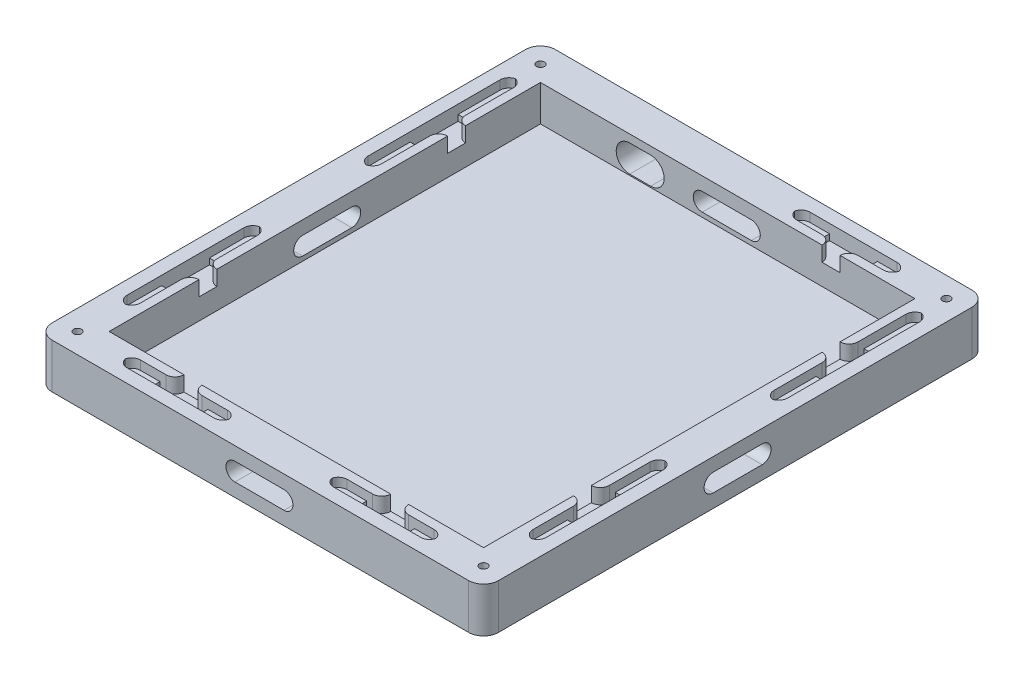
from build123d import *

# Parameters (mm, degrees)
FLOOR_2_DEPTH            = 3
BOSS_EXTRUDE1_DEPTH      = 12
BOSS_EXTRUDE1_DEPTH_BACK = 3
SKETCH4_W                = 149
SKETCH4_H                = 168
SKETCH4_W_2              = 125
SKETCH4_H_2              = 144
FILLET1_R                = 5
FILLET2_R                = 5
FILLET3_R                = 5
FILLET4_R                = 5
CUT_EXTRUDE1_DEPTH       = 3
CUT_EXTRUDE2_DEPTH       = 2
CUT_EXTRUDE3_DEPTH       = 172.703232352
CUT_EXTRUDE4_DEPTH       = 185.388855412
SKETCH9_R                = 1.325
CUT_EXTRUDE5_DEPTH       = 17
SKETCH10_R               = 3
CUT_EXTRUDE6_DEPTH       = 5
SKETCH11_R               = 6.25
CUT_EXTRUDE7_DEPTH       = 1
CUT_EXTRUDE8_DEPTH       = 20
FILLET5_R                = 3
FILLET6_R                = 3
FILLET7_R                = 3
FILLET8_R                = 3
FILLET9_R                = 3
FILLET10_R               = 3
FILLET11_R               = 3
FILLET12_R               = 3


# Some blends are built 0.0001 mm under size
with BuildPart() as part:
    # Sketch1 → Floor 2 (new body)
    with BuildSketch(Plane(origin=(0, 0, 0), x_dir=(1, 0, 0), z_dir=(0, 1, 0))):
        Polygon((-62.5, 55.915), (-62.5, 72), (-47.54, 72), (46.365, 72), (62.5, 72), (62.5, 55.915), (62.5, -57.04), (62.5, -72), (46.365, -72), (-47.54, -72), (-62.5, -72), (-62.5, -57.04), align=None)
    extrude(amount=FLOOR_2_DEPTH)

    # Sketch4 → Boss-Extrude1 (add, two sides: drawn at the far end of the back side and taken through both)
    with BuildSketch(Plane(origin=(0, 3, 0), x_dir=(1, 0, 0), z_dir=(0, 1, 0)).offset(-BOSS_EXTRUDE1_DEPTH_BACK)):
        Rectangle(SKETCH4_W, SKETCH4_H)
        Rectangle(SKETCH4_W_2, SKETCH4_H_2, mode=Mode.SUBTRACT)
    extrude(amount=BOSS_EXTRUDE1_DEPTH + BOSS_EXTRUDE1_DEPTH_BACK)

    # Fillet1
    fillet1_edges = [part.edges().sort_by_distance(p)[0] for p in [
        (-74.5, 7.5, 84),
    ]]
    fillet(fillet1_edges, radius=FILLET1_R)

    # Fillet2
    fillet2_edges = [part.edges().sort_by_distance(p)[0] for p in [
        (74.5, 7.5, 84),
    ]]
    fillet(fillet2_edges, radius=FILLET2_R)

    # Fillet3
    fillet3_edges = [part.edges().sort_by_distance(p)[0] for p in [
        (74.5, 7.5, -84),
    ]]
    fillet(fillet3_edges, radius=FILLET3_R)

    # Fillet4
    fillet4_edges = [part.edges().sort_by_distance(p)[0] for p in [
        (-74.5, 7.5, -84),
    ]]
    fillet(fillet4_edges, radius=FILLET4_R)

    # Sketch5 → Cut-Extrude1 (cut)
    with BuildSketch(Plane(origin=(0, 15, 0), x_dir=(1, 0, 0), z_dir=(0, 1, 0))):
        Polygon((-62.5, 47), (-62.5, 41), (-65.5, 41), (-65.5, 19), (-70, 19), (-70, 69), (-65.5, 69), (-65.5, 47), align=None)
        Polygon((-62.5, -36), (-62.5, -42), (-65.5, -42), (-65.5, -61.5), (-70, -61.5), (-70, -16.5), (-65.5, -16.5), (-65.5, -36), align=None)
        Polygon((62.5, -36), (62.5, -42), (65.5, -42), (65.5, -61.5), (70, -61.5), (70, -16.5), (65.5, -16.5), (65.5, -36), align=None)
        Polygon((62.5, 47), (62.5, 41), (65.5, 41), (65.5, 19), (70, 19), (70, 69), (65.5, 69), (65.5, 47), align=None)
        Polygon((31.5, 72), (37.5, 72), (37.5, 75), (52, 75), (52, 79.5), (17, 79.5), (17, 75), (31.5, 75), align=None)
        Polygon((-37.5, -72), (-31.5, -72), (-31.5, -75), (-17, -75), (-17, -79.5), (-52, -79.5), (-52, -75), (-37.5, -75), align=None)
        Polygon((31.5, -72), (37.5, -72), (37.5, -75), (52, -75), (52, -79.5), (17, -79.5), (17, -75), (31.5, -75), align=None)
    extrude(amount=-CUT_EXTRUDE1_DEPTH, mode=Mode.SUBTRACT)

    # Sketch6 → Cut-Extrude2 (cut)
    with BuildSketch(Plane(origin=(0, 12, 0), x_dir=(1, 0, 0), z_dir=(0, 1, 0))):
        Polygon((31.5, 72), (37.5, 72), (37.5, 75), (42.5, 75), (42.5, 79.5), (26.5, 79.5), (26.5, 75), (31.5, 75), align=None)
        Polygon((62.5, 47), (62.5, 41), (65.5, 41), (65.5, 36), (70, 36), (70, 52), (65.5, 52), (65.5, 47), align=None)
        Polygon((-62.5, 47), (-65.5, 47), (-65.5, 52), (-70, 52), (-70, 36), (-65.5, 36), (-65.5, 41), (-62.5, 41), align=None)
        Polygon((-62.5, -36), (-65.5, -36), (-65.5, -31), (-70, -31), (-70, -47), (-65.5, -47), (-65.5, -42), (-62.5, -42), align=None)
        Polygon((-37.5, -72), (-37.5, -75), (-42.5, -75), (-42.5, -79.5), (-26.5, -79.5), (-26.5, -75), (-31.5, -75), (-31.5, -72), align=None)
        Polygon((31.5, -72), (31.5, -75), (26.5, -75), (26.5, -79.5), (42.5, -79.5), (42.5, -75), (37.5, -75), (37.5, -72), align=None)
        Polygon((62.5, -36), (62.5, -42), (65.5, -42), (65.5, -47), (70, -47), (70, -31), (65.5, -31), (65.5, -36), align=None)
    extrude(amount=-CUT_EXTRUDE2_DEPTH, mode=Mode.SUBTRACT)

    # Sketch7 → Cut-Extrude3 (cut, through all)
    with BuildSketch(Plane.ZY.offset(74.5)):
        with BuildLine():
            Line((-9, 10.5), (7.38, 10.5))
            ThreePointArc((7.38, 10.5), (10.38, 7.5), (7.38, 4.5))
            Line((7.38, 4.5), (-9, 4.5))
            ThreePointArc((-9, 4.5), (-12, 7.5), (-9, 10.5))
        make_face()
    extrude(amount=-CUT_EXTRUDE3_DEPTH, mode=Mode.SUBTRACT)

    # Sketch8 → Cut-Extrude4 (cut, through all)
    with BuildSketch(Plane.XY.offset(84)):
        with BuildLine():
            Line((-8.5, 10.5), (7.88, 10.5))
            ThreePointArc((7.88, 10.5), (10.88, 7.5), (7.88, 4.5))
            Line((7.88, 4.5), (-8.5, 4.5))
            ThreePointArc((-8.5, 4.5), (-11.5, 7.5), (-8.5, 10.5))
        make_face()
    extrude(amount=-CUT_EXTRUDE4_DEPTH, mode=Mode.SUBTRACT)

    # Sketch9 → Cut-Extrude5 (cut)
    with BuildSketch(Plane.XZ):
        with Locations(Location((-67.767766953, 77.267766953, 0), (0, 0, 270))):
            Circle(SKETCH9_R)
        with Locations(Location((67.767766953, 77.267766953, 0), (0, 0, 270))):
            Circle(SKETCH9_R)
        with Locations(Location((67.767766953, -77.267766953, 0), (0, 0, 270))):
            Circle(SKETCH9_R)
        with Locations(Location((-67.767766953, -77.267766953, 0), (0, 0, 270))):
            Circle(SKETCH9_R)
    extrude(amount=-CUT_EXTRUDE5_DEPTH, mode=Mode.SUBTRACT)

    # Sketch10 → Cut-Extrude6 (cut)
    with BuildSketch(Plane.XZ):
        with Locations(Location((-67.767766953, 77.267766953, 0), (0, 0, 270))):
            Circle(SKETCH10_R)
        with Locations(Location((67.767766953, 77.267766953, 0), (0, 0, 270))):
            Circle(SKETCH10_R)
        with Locations(Location((67.767766953, -77.267766953, 0), (0, 0, 270))):
            Circle(SKETCH10_R)
        with Locations(Location((-67.767766953, -77.267766953, 0), (0, 0, 270))):
            Circle(SKETCH10_R)
    extrude(amount=-CUT_EXTRUDE6_DEPTH, mode=Mode.SUBTRACT)

    # Sketch11 → Cut-Extrude7 (cut)
    with BuildSketch(Plane.XZ):
        with Locations(Location((-42.5, 52, 0), (0, 0, 270))):
            Circle(SKETCH11_R)
        with Locations(Location((42.5, 52, 0), (0, 0, 270))):
            Circle(SKETCH11_R)
        with Locations(Location((-42.5, -52, 0), (0, 0, 270))):
            Circle(SKETCH11_R)
        with Locations(Location((42.5, -52, 0), (0, 0, 270))):
            Circle(SKETCH11_R)
    extrude(amount=-CUT_EXTRUDE7_DEPTH, mode=Mode.SUBTRACT)

    # Sketch12 → Cut-Extrude8 (cut)
    with BuildSketch(Plane(origin=(0, 0, -84), x_dir=(-1, 0, 0), z_dir=(0, 0, -1))):
        with BuildLine():
            Line((32.713, 3.4), (25.713, 3.4))
            ThreePointArc((25.713, 3.4), (21.213, 7.9), (25.713, 12.4))
            Line((25.713, 12.4), (32.713, 12.4))
            ThreePointArc((32.713, 12.4), (37.213, 7.9), (32.713, 3.4))
        make_face()
    extrude(amount=-CUT_EXTRUDE8_DEPTH, mode=Mode.SUBTRACT)

    # Fillet5
    # the kernel refuses this fillet: 3 mm, written as the material it adds along each edge
    with BuildSketch(Plane(origin=(17, 15, -75), x_dir=(1, 0, 0), z_dir=(0, -1, 0)), Plane(origin=(17, 15, -79.5), x_dir=(0, 0, 1), z_dir=(0, -1, 0)), Plane(origin=(52, 15, -75), x_dir=(0, 0, -1), z_dir=(0, -1, 0)), Plane(origin=(52, 15, -79.5), x_dir=(-1, 0, 0), z_dir=(0, -1, 0))) as fillet5_piece_1:
        with BuildLine():
            CenterArc((FILLET5_R, -FILLET5_R), FILLET5_R, 90, 90)
            Line((0, -FILLET5_R), (0, 0))
            Line((0, 0), (FILLET5_R, 0))
        make_face()
    extrude(amount=10.5)

    # Fillet6
    fillet6_edges = [part.edges().sort_by_distance(p)[0] for p in [
        (37.5, 12.5, -75),
        (31.5, 12.5, -75),
    ]]
    fillet(fillet6_edges, radius=FILLET6_R - 0.0001)  # a hair under: the kernel refuses the full size

    # Fillet7
    # the kernel refuses this fillet: 3 mm, written as the material it adds along each edge
    with BuildSketch(Plane(origin=(65.5, 15, -19), x_dir=(1, 0, 0), z_dir=(0, -1, 0)), Plane(origin=(70, 15, -19), x_dir=(0, 0, -1), z_dir=(0, -1, 0)), Plane(origin=(70, 15, -69), x_dir=(-1, 0, 0), z_dir=(0, -1, 0)), Plane(origin=(65.5, 15, -69), x_dir=(0, 0, 1), z_dir=(0, -1, 0))) as fillet7_piece_1:
        with BuildLine():
            CenterArc((FILLET7_R, -FILLET7_R), FILLET7_R, 90, 90)
            Line((0, -FILLET7_R), (0, 0))
            Line((0, 0), (FILLET7_R, 0))
        make_face()
    extrude(amount=10.5)
    # the kernel refuses this fillet: 3 mm, written as the material it takes off along each edge
    with BuildSketch(Plane(origin=(65.5, 10, -41), x_dir=(0, 0, 1), z_dir=(0, 1, 0)), Plane(origin=(65.5, 10, -47), x_dir=(-1, 0, 0), z_dir=(0, 1, 0))) as fillet7_2_piece_1:
        with BuildLine():
            CenterArc((FILLET7_R, -FILLET7_R), FILLET7_R, 90, 90)
            Line((0, -FILLET7_R), (0, 0))
            Line((0, 0), (FILLET7_R, 0))
        make_face()
    extrude(amount=12.5, mode=Mode.SUBTRACT)

    # Fillet8
    # the kernel refuses this fillet: 3 mm, written as the material it adds along each edge
    with BuildSketch(Plane(origin=(65.5, 15, 61.5), x_dir=(0, 0, -1), z_dir=(0, -1, 0)), Plane(origin=(70, 15, 61.5), x_dir=(-1, 0, 0), z_dir=(0, -1, 0)), Plane(origin=(65.5, 15, 16.5), x_dir=(1, 0, 0), z_dir=(0, -1, 0)), Plane(origin=(70, 15, 16.5), x_dir=(0, 0, 1), z_dir=(0, -1, 0))) as fillet8_piece_1:
        with BuildLine():
            CenterArc((FILLET8_R, FILLET8_R), FILLET8_R, 180, 90)
            Line((0, FILLET8_R), (0, 0))
            Line((0, 0), (FILLET8_R, 0))
        make_face()
    extrude(amount=10.5)
    # the kernel refuses this fillet: 3 mm, written as the material it takes off along each edge
    with BuildSketch(Plane(origin=(65.5, 10, 42), x_dir=(-1, 0, 0), z_dir=(0, 1, 0)), Plane(origin=(65.5, 10, 36), x_dir=(0, 0, -1), z_dir=(0, 1, 0))) as fillet8_2_piece_1:
        with BuildLine():
            CenterArc((FILLET8_R, FILLET8_R), FILLET8_R, 180, 90)
            Line((0, FILLET8_R), (0, 0))
            Line((0, 0), (FILLET8_R, 0))
        make_face()
    extrude(amount=12.5, mode=Mode.SUBTRACT)

    # Fillet9
    # the kernel refuses this fillet: 3 mm, written as the material it adds along each edge
    with BuildSketch(Plane(origin=(17, 15, 75), x_dir=(1, 0, 0), z_dir=(0, -1, 0)), Plane(origin=(17, 15, 79.5), x_dir=(0, 0, -1), z_dir=(0, -1, 0)), Plane(origin=(52, 15, 79.5), x_dir=(-1, 0, 0), z_dir=(0, -1, 0)), Plane(origin=(52, 15, 75), x_dir=(0, 0, 1), z_dir=(0, -1, 0))) as fillet9_piece_1:
        with BuildLine():
            CenterArc((FILLET9_R, FILLET9_R), FILLET9_R, 180, 90)
            Line((0, FILLET9_R), (0, 0))
            Line((0, 0), (FILLET9_R, 0))
        make_face()
    extrude(amount=10.5)
    # the kernel refuses this fillet: 3 mm, written as the material it takes off along each edge
    with BuildSketch(Plane(origin=(31.5, 10, 75), x_dir=(0, 0, -1), z_dir=(0, 1, 0)), Plane(origin=(37.5, 10, 75), x_dir=(1, 0, 0), z_dir=(0, 1, 0))) as fillet9_2_piece_1:
        with BuildLine():
            CenterArc((FILLET9_R, FILLET9_R), FILLET9_R, 180, 90)
            Line((0, FILLET9_R), (0, 0))
            Line((0, 0), (FILLET9_R, 0))
        make_face()
    extrude(amount=12.5, mode=Mode.SUBTRACT)

    # Fillet10
    # the kernel refuses this fillet: 3 mm, written as the material it adds along each edge
    with BuildSketch(Plane(origin=(-52, 15, 75), x_dir=(1, 0, 0), z_dir=(0, -1, 0)), Plane(origin=(-52, 15, 79.5), x_dir=(0, 0, -1), z_dir=(0, -1, 0)), Plane(origin=(-17, 15, 79.5), x_dir=(-1, 0, 0), z_dir=(0, -1, 0)), Plane(origin=(-17, 15, 75), x_dir=(0, 0, 1), z_dir=(0, -1, 0))) as fillet10_piece_1:
        with BuildLine():
            CenterArc((FILLET10_R, FILLET10_R), FILLET10_R, 180, 90)
            Line((0, FILLET10_R), (0, 0))
            Line((0, 0), (FILLET10_R, 0))
        make_face()
    extrude(amount=10.5)
    # the kernel refuses this fillet: 3 mm, written as the material it takes off along each edge
    with BuildSketch(Plane(origin=(-37.5, 10, 75), x_dir=(0, 0, -1), z_dir=(0, 1, 0)), Plane(origin=(-31.5, 10, 75), x_dir=(1, 0, 0), z_dir=(0, 1, 0))) as fillet10_2_piece_1:
        with BuildLine():
            CenterArc((FILLET10_R, FILLET10_R), FILLET10_R, 180, 90)
            Line((0, FILLET10_R), (0, 0))
            Line((0, 0), (FILLET10_R, 0))
        make_face()
    extrude(amount=12.5, mode=Mode.SUBTRACT)

    # Fillet11
    # the kernel refuses this fillet: 3 mm, written as the material it adds along each edge
    with BuildSketch(Plane(origin=(-65.5, 15, 16.5), x_dir=(0, 0, 1), z_dir=(0, -1, 0)), Plane(origin=(-70, 15, 16.5), x_dir=(1, 0, 0), z_dir=(0, -1, 0)), Plane(origin=(-70, 15, 61.5), x_dir=(0, 0, -1), z_dir=(0, -1, 0)), Plane(origin=(-65.5, 15, 61.5), x_dir=(-1, 0, 0), z_dir=(0, -1, 0))) as fillet11_piece_1:
        with BuildLine():
            CenterArc((FILLET11_R, FILLET11_R), FILLET11_R, 180, 90)
            Line((0, FILLET11_R), (0, 0))
            Line((0, 0), (FILLET11_R, 0))
        make_face()
    extrude(amount=10.5)
    # the kernel refuses this fillet: 3 mm, written as the material it takes off along each edge
    with BuildSketch(Plane(origin=(-65.5, 10, 36), x_dir=(1, 0, 0), z_dir=(0, 1, 0)), Plane(origin=(-65.5, 10, 42), x_dir=(0, 0, 1), z_dir=(0, 1, 0))) as fillet11_2_piece_1:
        with BuildLine():
            CenterArc((FILLET11_R, FILLET11_R), FILLET11_R, 180, 90)
            Line((0, FILLET11_R), (0, 0))
            Line((0, 0), (FILLET11_R, 0))
        make_face()
    extrude(amount=12.5, mode=Mode.SUBTRACT)

    # Fillet12
    # the kernel refuses this fillet: 3 mm, written as the material it adds along each edge
    with BuildSketch(Plane(origin=(-65.5, 15, -69), x_dir=(0, 0, 1), z_dir=(0, -1, 0)), Plane(origin=(-70, 15, -69), x_dir=(1, 0, 0), z_dir=(0, -1, 0)), Plane(origin=(-70, 15, -19), x_dir=(0, 0, -1), z_dir=(0, -1, 0)), Plane(origin=(-65.5, 15, -19), x_dir=(-1, 0, 0), z_dir=(0, -1, 0))) as fillet12_piece_1:
        with BuildLine():
            CenterArc((FILLET12_R, FILLET12_R), FILLET12_R, 180, 90)
            Line((0, FILLET12_R), (0, 0))
            Line((0, 0), (FILLET12_R, 0))
        make_face()
    extrude(amount=10.5)
    # the kernel refuses this fillet: 3 mm, written as the material it takes off along each edge
    with BuildSketch(Plane(origin=(-65.5, 10, -47), x_dir=(1, 0, 0), z_dir=(0, 1, 0)), Plane(origin=(-65.5, 10, -41), x_dir=(0, 0, 1), z_dir=(0, 1, 0))) as fillet12_2_piece_1:
        with BuildLine():
            CenterArc((FILLET12_R, FILLET12_R), FILLET12_R, 180, 90)
            Line((0, FILLET12_R), (0, 0))
            Line((0, 0), (FILLET12_R, 0))
        make_face()
    extrude(amount=12.5, mode=Mode.SUBTRACT)


solid = part.part
